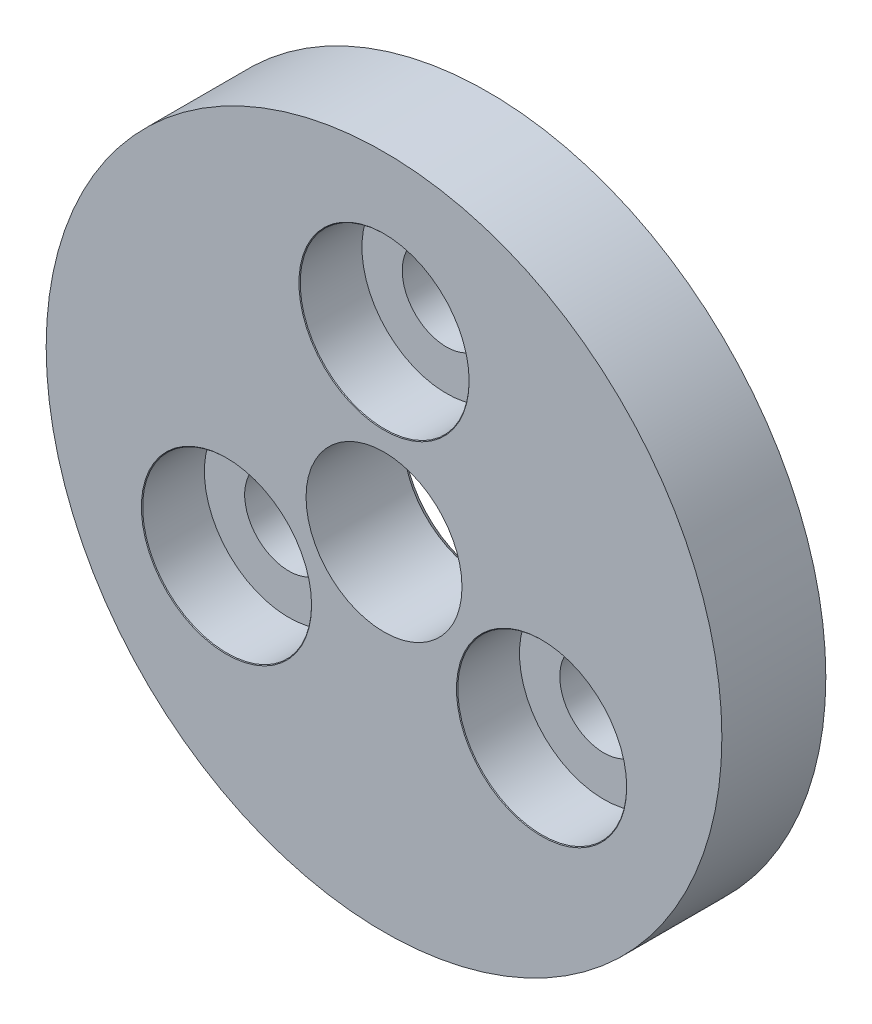
from build123d import *

# Parameters (mm, degrees)
SKETCH1_R                                    = 13
BOSS_EXTRUDE1_DEPTH                          = 4
F_6_0MM_DOWEL_HOLE1_D                        = 6
F_6_0MM_DOWEL_HOLE1_DEPTH                    = 12
F_6_0MM_DOWEL_HOLE1_CSINK_D                  = 6.5
F_6_0MM_DOWEL_HOLE1_CSINK_ANGLE              = 90
F_6_0MM_DOWEL_HOLE1_TIP                      = 1.802581857
CBORE_FOR_M3_HEX_SOCKET_THIN_HEAD_CA_2_COUNT = 2
CBORE_FOR_M3_HEX_SOCKET_THIN_HEAD_CA_2_PITCH = 12.124355653
CBORE_FOR_M3_HEX_SOCKET_THIN_HEAD_CA_3_COUNT = 2
CBORE_FOR_M3_HEX_SOCKET_THIN_HEAD_CA_3_PITCH = 12.124355653


with BuildPart() as part:
    # Sketch1 → Boss-Extrude1 (new body)
    with BuildSketch(Plane.XY):
        Circle(SKETCH1_R)
    extrude(amount=BOSS_EXTRUDE1_DEPTH)

    # Ø6.0mm Dowel Hole1
    with Locations(Plane(origin=(0, 0, 0), x_dir=(-1, 0, 0), z_dir=(0, 0, -1))):
        with Locations((0, 0)):
            CounterSinkHole(F_6_0MM_DOWEL_HOLE1_D / 2, F_6_0MM_DOWEL_HOLE1_CSINK_D / 2, depth=F_6_0MM_DOWEL_HOLE1_DEPTH, counter_sink_angle=F_6_0MM_DOWEL_HOLE1_CSINK_ANGLE)
            with Locations((0, 0, -(F_6_0MM_DOWEL_HOLE1_DEPTH + F_6_0MM_DOWEL_HOLE1_TIP / 2))):  # 118° drill point
                Cone(0, F_6_0MM_DOWEL_HOLE1_D / 2, F_6_0MM_DOWEL_HOLE1_TIP, mode=Mode.SUBTRACT)

    # Sketch7 → CBORE for M3 Hex Socket Thin Head Cap Screw1 (revolve, cut)
    with BuildSketch(Plane(origin=(-6.062177826, -3.5, 4), x_dir=(0, -1, 0), z_dir=(1, 0, 0))):
        Polygon((0, 0), (0, 13.021463052), (1.7, 12), (1.7, 2.4), (3.25, 2.4), (3.25, 0.025), (3.275, 0), align=None)
    cbore_for_m3_hex_socket_thin_head_cap_sc = revolve(axis=Axis((-6.062177826, -3.5, 10.35), (0, 0, -1)), mode=Mode.SUBTRACT)

    # CBORE for M3 Hex Socket Thin Head Ca 2: CBORE for M3 Hex Socket Thin Head Cap Screw1 ×2
    with Locations(*[Vector(0.4999999999999634, 0.8660254037844598, 0) * (i * CBORE_FOR_M3_HEX_SOCKET_THIN_HEAD_CA_2_PITCH) for i in range(1, CBORE_FOR_M3_HEX_SOCKET_THIN_HEAD_CA_2_COUNT)]):
        add(cbore_for_m3_hex_socket_thin_head_cap_sc, mode=Mode.SUBTRACT)

    # CBORE for M3 Hex Socket Thin Head Ca 3: CBORE for M3 Hex Socket Thin Head Cap Screw1 ×2
    with Locations(*[(i * CBORE_FOR_M3_HEX_SOCKET_THIN_HEAD_CA_3_PITCH, 0, 0) for i in range(1, CBORE_FOR_M3_HEX_SOCKET_THIN_HEAD_CA_3_COUNT)]):
        add(cbore_for_m3_hex_socket_thin_head_cap_sc, mode=Mode.SUBTRACT)


solid = part.part
